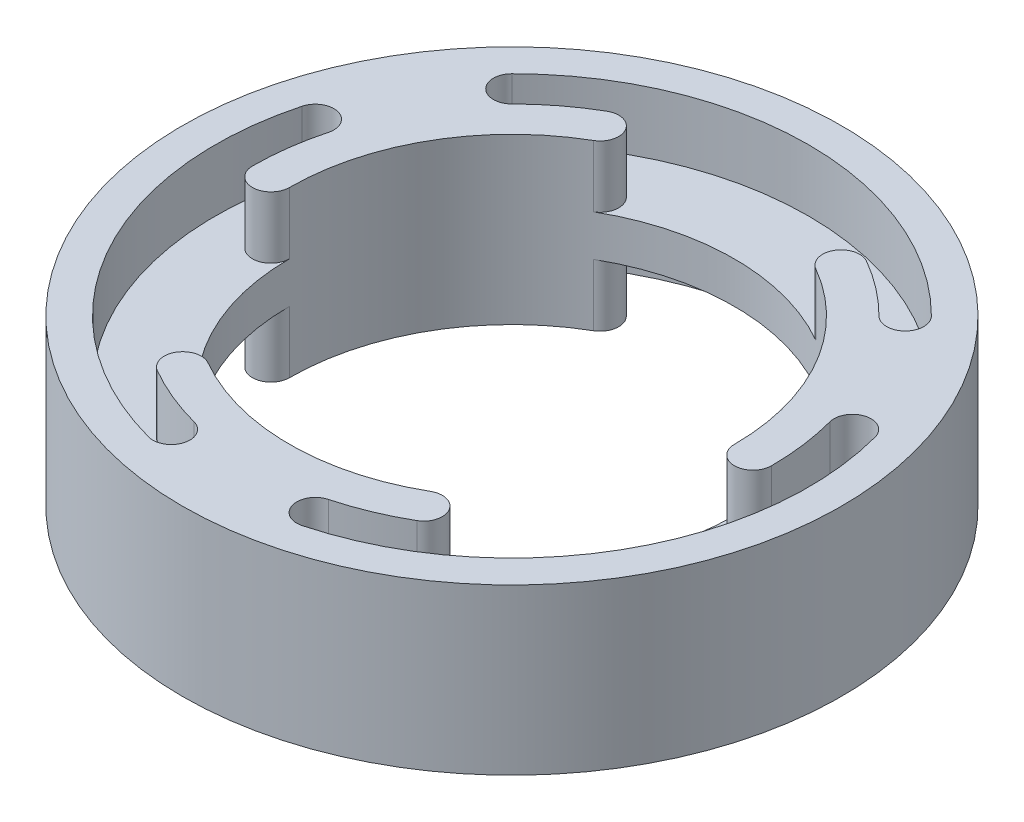
from build123d import *

# Parameters (mm, degrees)
ESQUISSE1_R              = 40
ESQUISSE1_R_2            = 25
BOSS_EXTRU_1_DEPTH       = 20
EMPREINTE1_OUTLINE_R     = 25
EMPREINTE1_DEPTH         = 7.5
EMPREINTE1_START         = 12.5
EMPREINTE1_2_OUTLINE_R   = 25
EMPREINTE1_2_DEPTH       = 7.5
EMPREINTE1_START_2       = 7.5
EMPREINTE1_3_OUTLINE_R   = 27
EMPREINTE1_3_OUTLINE_R_2 = 25
EMPREINTE1_3_DEPTH       = 5


# Read off the part's stored shape, not the designer's step: Empreinte1
with BuildPart() as part:
    # Esquisse1 → Boss.-Extru.1 (new body)
    with BuildSketch(Plane(origin=(0, 0, 0), x_dir=(1, 0, 0), z_dir=(0, 1, 0))):
        with Locations(Location((0, 0, 0), (0, 0, 270))):
            Circle(ESQUISSE1_R)
        with Locations(Location((0, 0, 0), (0, 0, 270))):
            Circle(ESQUISSE1_R_2, mode=Mode.SUBTRACT)
    extrude(amount=BOSS_EXTRU_1_DEPTH)

    # Empreinte1 outline → Empreinte1 (cut)
    with BuildSketch(Plane(origin=(0, 0, 0), x_dir=(1, 0, 0), z_dir=(0, 1, 0))):
        with BuildLine():
            ThreePointArc((-15.75, 27.279800219), (-12.676442841, 26.456243061), (-13.5, 23.382685902))
            ThreePointArc((-13.5, 23.382685902), (-23.382685902, 13.5), (-27, 0))
            ThreePointArc((-27, 0), (-29.25, -2.25), (-31.5, 0))
            ThreePointArc((-31.5, 0), (-31.230513133, 4.111575055), (-30.426663528, 8.152799921))
            ThreePointArc((-30.426663528, 8.152799921), (-32.017653786, 10.908475881), (-34.773329746, 9.317485624))
            ThreePointArc((-34.773329746, 9.317485624), (-31.176914536, -18), (-9.317485624, -34.773329746))
            ThreePointArc((-9.317485624, -34.773329746), (-6.561809663, -33.182339489), (-8.152799921, -30.426663528))
            ThreePointArc((-8.152799921, -30.426663528), (-12.05452812, -29.102205274), (-15.75, -27.279800219))
            ThreePointArc((-15.75, -27.279800219), (-16.573557159, -24.20624306), (-13.5, -23.382685902))
            ThreePointArc((-13.5, -23.382685902), (0, -27), (13.5, -23.382685902))
            ThreePointArc((13.5, -23.382685902), (16.573557159, -24.20624306), (15.75, -27.279800219))
            ThreePointArc((15.75, -27.279800219), (12.05452812, -29.102205274), (8.152799921, -30.426663528))
            ThreePointArc((8.152799921, -30.426663528), (6.561809663, -33.182339489), (9.317485624, -34.773329746))
            ThreePointArc((9.317485624, -34.773329746), (31.176914536, -18), (34.773329746, 9.317485624))
            ThreePointArc((34.773329746, 9.317485624), (32.017653786, 10.908475881), (30.426663528, 8.152799921))
            ThreePointArc((30.426663528, 8.152799921), (31.230513133, 4.111575055), (31.5, 0))
            ThreePointArc((31.5, 0), (29.25, -2.25), (27, 0))
            ThreePointArc((27, 0), (23.382685902, 13.5), (13.5, 23.382685902))
            ThreePointArc((13.5, 23.382685902), (12.676442841, 26.456243061), (15.75, 27.279800219))
            ThreePointArc((15.75, 27.279800219), (19.175985014, 24.990630219), (22.273863607, 22.273863607))
            ThreePointArc((22.273863607, 22.273863607), (25.455844123, 22.273863607), (25.455844123, 25.455844123))
            ThreePointArc((25.455844123, 25.455844123), (0, 36), (-25.455844123, 25.455844123))
            ThreePointArc((-25.455844123, 25.455844123), (-25.455844123, 22.273863607), (-22.273863607, 22.273863607))
            ThreePointArc((-22.273863607, 22.273863607), (-19.175985014, 24.990630219), (-15.75, 27.279800219))
        make_face()
        Circle(EMPREINTE1_OUTLINE_R, mode=Mode.SUBTRACT)
    extrude(amount=EMPREINTE1_DEPTH, mode=Mode.SUBTRACT)

    # Empreinte1 2 outline → Empreinte1 2 (cut)
    with BuildSketch(Plane(origin=(0, 0, 0), x_dir=(1, 0, 0), z_dir=(0, 1, 0)).offset(EMPREINTE1_START)):
        with BuildLine():
            ThreePointArc((-15.75, 27.279800219), (-12.676442841, 26.456243061), (-13.5, 23.382685902))
            ThreePointArc((-13.5, 23.382685902), (-23.382685902, 13.5), (-27, 0))
            ThreePointArc((-27, 0), (-29.25, -2.25), (-31.5, 0))
            ThreePointArc((-31.5, 0), (-31.230513133, 4.111575055), (-30.426663528, 8.152799921))
            ThreePointArc((-30.426663528, 8.152799921), (-32.017653786, 10.908475881), (-34.773329746, 9.317485624))
            ThreePointArc((-34.773329746, 9.317485624), (-31.176914536, -18), (-9.317485624, -34.773329746))
            ThreePointArc((-9.317485624, -34.773329746), (-6.561809663, -33.182339489), (-8.152799921, -30.426663528))
            ThreePointArc((-8.152799921, -30.426663528), (-12.05452812, -29.102205274), (-15.75, -27.279800219))
            ThreePointArc((-15.75, -27.279800219), (-16.573557159, -24.20624306), (-13.5, -23.382685902))
            ThreePointArc((-13.5, -23.382685902), (0, -27), (13.5, -23.382685902))
            ThreePointArc((13.5, -23.382685902), (16.573557159, -24.20624306), (15.75, -27.279800219))
            ThreePointArc((15.75, -27.279800219), (12.05452812, -29.102205274), (8.152799921, -30.426663528))
            ThreePointArc((8.152799921, -30.426663528), (6.561809663, -33.182339489), (9.317485624, -34.773329746))
            ThreePointArc((9.317485624, -34.773329746), (31.176914536, -18), (34.773329746, 9.317485624))
            ThreePointArc((34.773329746, 9.317485624), (32.017653786, 10.908475881), (30.426663528, 8.152799921))
            ThreePointArc((30.426663528, 8.152799921), (31.230513133, 4.111575055), (31.5, 0))
            ThreePointArc((31.5, 0), (29.25, -2.25), (27, 0))
            ThreePointArc((27, 0), (23.382685902, 13.5), (13.5, 23.382685902))
            ThreePointArc((13.5, 23.382685902), (12.676442841, 26.456243061), (15.75, 27.279800219))
            ThreePointArc((15.75, 27.279800219), (19.175985014, 24.990630219), (22.273863607, 22.273863607))
            ThreePointArc((22.273863607, 22.273863607), (25.455844123, 22.273863607), (25.455844123, 25.455844123))
            ThreePointArc((25.455844123, 25.455844123), (0, 36), (-25.455844123, 25.455844123))
            ThreePointArc((-25.455844123, 25.455844123), (-25.455844123, 22.273863607), (-22.273863607, 22.273863607))
            ThreePointArc((-22.273863607, 22.273863607), (-19.175985014, 24.990630219), (-15.75, 27.279800219))
        make_face()
        Circle(EMPREINTE1_2_OUTLINE_R, mode=Mode.SUBTRACT)
    extrude(amount=EMPREINTE1_2_DEPTH, mode=Mode.SUBTRACT)

    # Empreinte1 3 outline → Empreinte1 3 (cut)
    with BuildSketch(Plane(origin=(0, 0, 0), x_dir=(1, 0, 0), z_dir=(0, 1, 0)).offset(EMPREINTE1_START_2)):
        Circle(EMPREINTE1_3_OUTLINE_R)
        Circle(EMPREINTE1_3_OUTLINE_R_2, mode=Mode.SUBTRACT)
    extrude(amount=EMPREINTE1_3_DEPTH, mode=Mode.SUBTRACT)


solid = part.part
